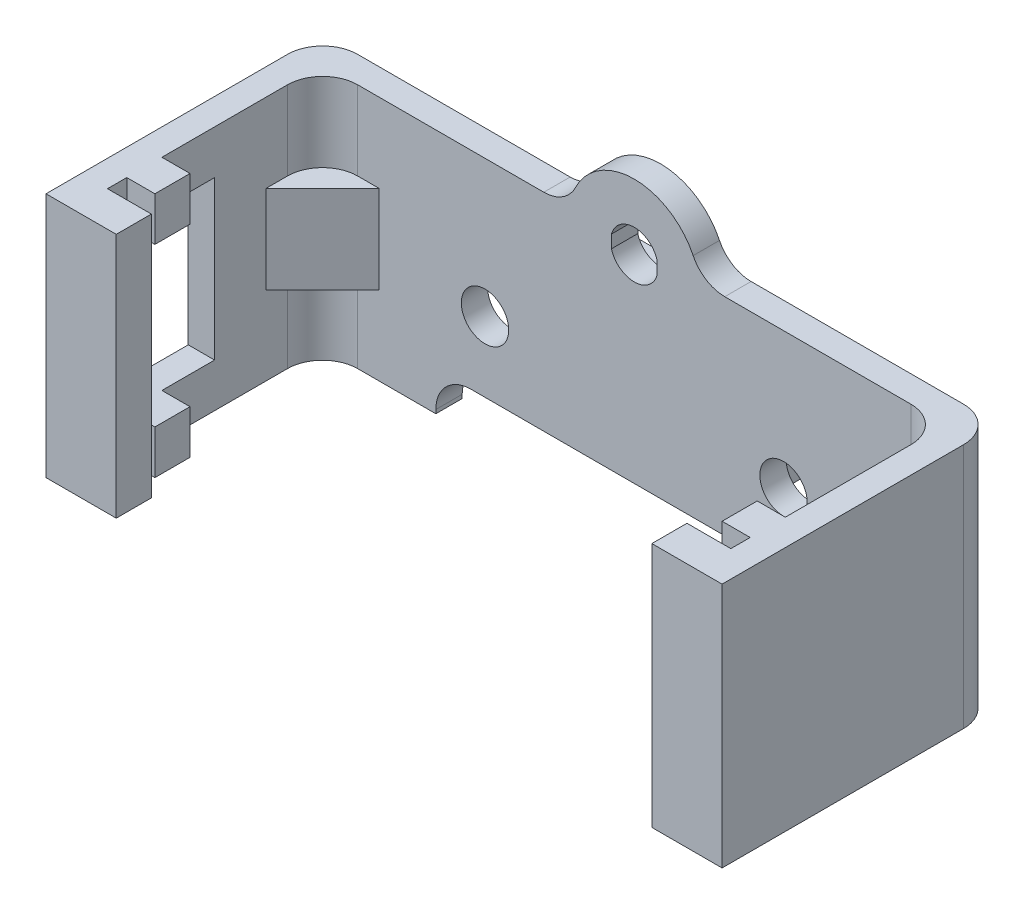
from build123d import *

# Parameters (mm, degrees)
SKETCH_1_W               = 27
SKETCH_1_H               = 17
EXTRUDE_1_DEPTH          = 1
SKETCH_2_R               = 2.55
CUT_EXTRUDE_1_DEPTH      = 16.984367363
EXTRUDE_2_DEPTH          = 17
SKETCH_6_W               = 1.5
SKETCH_6_H               = 2
EXTRUDE_3_DEPTH          = 2
CHAMFER_1_SIZE           = 1
CUT_EXTRUDE_4_REACH      = 39.316
SKETCH_8_R               = 2
FILLET_1_R               = 3
SKETCH_9_W               = 7
SKETCH_9_H               = 13
EXTRUDE_4_DEPTH          = 1.5
SKETCH_7_R               = 1.35
CUT_EXTRUDE_5_DEPTH      = 10
CUT_EXTRUDE_6_REACH      = 41.373
FILLET_2_R               = 2.2
SKETCH_13_W              = 11.6
SKETCH_13_H              = 5.4
EXTRUDE_6_DEPTH          = 4
CUT_EXTRUDE_7_DEPTH      = 44.188540186
CUT_EXTRUDE_7_DEPTH_BACK = 44.188540186
SKETCH_14_OUTSIDE_W      = 46.664
SKETCH_14_OUTSIDE_H      = 47.664
SKETCH_14_OUTSIDE_W_2    = 27
SKETCH_14_OUTSIDE_H_2    = 5.5
EXTRUDE_7_DEPTH          = 3.5
EXTRUDE_7_DEPTH_BACK     = 10.5
SKETCH_16_W              = 5.6
SKETCH_16_H              = 1.5
SKETCH_16_W_2            = 4.4
SKETCH_16_W_3            = 12.2
EXTRUDE_8_DEPTH          = 2
EXTRUDE_9_DEPTH          = 2.5
CUT_EXTRUDE_8_REACH      = 54.983
SKETCH_18_W              = 5
SKETCH_18_H              = 9
EXTRUDE_START            = -1.5
SKETCH_19_R              = 3.726433752
SKETCH_19_R_2            = 1.35
SKETCH_19_W              = 24.8
SKETCH_19_H              = 1.288897449
EXTRUDE_10_DEPTH         = 1.5
FILLET_4_R               = 2


# Some blends are built 0.0001 mm under size
with BuildPart() as part:
    # 草图1 → 凸台-拉伸1 (new body)
    with BuildSketch(Plane.XY):
        Rectangle(SKETCH_1_W, SKETCH_1_H)
    extrude(amount=EXTRUDE_1_DEPTH)

    # 草图2 → 切除-拉伸1 (cut, through all)
    with BuildSketch(Plane.XY.offset(1)):
        with Locations((0, 4.125)):
            Circle(SKETCH_2_R)
        with Locations((0, -4.125)):
            Circle(SKETCH_2_R)
        with Locations((8.27, 4.125)):
            Circle(SKETCH_2_R)
        with Locations((8.27, -4.125)):
            Circle(SKETCH_2_R)
        with Locations((-8.27, 4.125)):
            Circle(SKETCH_2_R)
        with Locations((-8.27, -4.125)):
            Circle(SKETCH_2_R)
    extrude(amount=-CUT_EXTRUDE_1_DEPTH, mode=Mode.SUBTRACT)

    # 草图3 → 凸台-拉伸2 (add)
    with BuildSketch(Plane.XZ.offset(8.5)):
        Polygon((13.5, 0), (19, 0), (19, -28.5), (-13.5, -28.5), (-13.5, -30), (20.5, -30), (20.5, 1), (13.5, 1), align=None)
    extrude(amount=-EXTRUDE_2_DEPTH)

    # 草图6 → 凸台-拉伸3 (add, symmetric)
    with BuildSketch(Plane(origin=(0, 0, 0), x_dir=(1, 0, 0), z_dir=(0, 1, 0))):
        Polygon((19, 0), (19, 5), (14, 0), align=None)
        Polygon((19, 28.5), (14, 28.5), (19, 23.5), align=None)
        with Locations((18.25, 20)):
            Rectangle(SKETCH_6_W, SKETCH_6_H)
    extrude(amount=EXTRUDE_3_DEPTH, both=True)

    # 倒角1
    chamfer_1_edges = [part.edges().sort_by_distance(p)[0] for p in [
        (-13.5, 0, 0),
    ]]
    chamfer(chamfer_1_edges, length=CHAMFER_1_SIZE - 0.0001)  # a hair under: the kernel refuses the full size

    # 草图8 → 切除-拉伸4 (cut, up to next)
    with BuildSketch(Plane(origin=(0, 0, 0), x_dir=(-1, 0, 0), z_dir=(0, 0, -1)), mode=Mode.PRIVATE) as cut_extrude_4_sk1:
        Circle(SKETCH_8_R)
    cut_extrude_4_tool1 = extrude(cut_extrude_4_sk1.sketch, amount=-CUT_EXTRUDE_4_REACH, mode=Mode.PRIVATE) & part.part
    add(cut_extrude_4_tool1.solids().sort_by_distance((0, 0, 0))[0], mode=Mode.SUBTRACT)

    # 圆角1
    fillet_1_edges = [part.edges().sort_by_distance(p)[0] for p in [
        (20.5, 0, 1),
        (20.5, 0, -30),
        (19, 5.25, -28.5),
        (19, 5.25, 0),
        (19, -5.25, 0),
        (19, -5.25, -28.5),
    ]]
    fillet(fillet_1_edges, radius=FILLET_1_R)

    # 草图9 → 凸台-拉伸4 (add)
    with BuildSketch(Plane(origin=(0, 0, -30), x_dir=(-1, 0, 0), z_dir=(0, 0, -1))):
        with Locations((0, 6.5)):
            Rectangle(SKETCH_9_W, SKETCH_9_H)
    extrude(amount=-EXTRUDE_4_DEPTH)

    # 草图7 → 切除-拉伸5 (cut)
    with BuildSketch(Plane(origin=(0, 0, -30), x_dir=(-1, 0, 0), z_dir=(0, 0, -1))):
        with Locations((0, 10)):
            Circle(SKETCH_7_R)
        with Locations((-8.5, 2.7)):
            Circle(SKETCH_7_R)
        with Locations((8.5, 2.7)):
            Circle(SKETCH_7_R)
    extrude(amount=-CUT_EXTRUDE_5_DEPTH, mode=Mode.SUBTRACT)

    # 草图11 → 切除-拉伸6 (cut, up to next)
    with BuildSketch(Plane(origin=(0, 0, -30), x_dir=(-1, 0, 0), z_dir=(0, 0, -1)), mode=Mode.PRIVATE) as cut_extrude_6_sk1:
        with BuildLine():
            Line((13.5, -8.5), (13.5, 0))
            Line((13.5, 0), (-9, 0))
            ThreePointArc((-9, 0), (-15.01040764, -2.48959236), (-17.5, -8.5))
            Line((-17.5, -8.5), (13.5, -8.5))
        make_face()
    cut_extrude_6_tool1 = extrude(cut_extrude_6_sk1.sketch, amount=-CUT_EXTRUDE_6_REACH, mode=Mode.PRIVATE) & part.part
    add(cut_extrude_6_tool1.solids().sort_by_distance((1.149624, -4.397011, -30))[0], mode=Mode.SUBTRACT)

    # 圆角2
    fillet_2_edges = [part.edges().sort_by_distance(p)[0] for p in [
        (-3.5, 13, -29.25),
        (-3.5, 8.5, -29.25),
        (3.5, 13, -29.25),
        (3.5, 8.5, -29.25),
        (-13.5, 0, -29.25),
        (-13.5, 8.5, -29.25),
    ]]
    fillet(fillet_2_edges, radius=FILLET_2_R)

    # 草图13 → 凸台-拉伸6 (add)
    with BuildSketch(Plane(origin=(0, 0, -30), x_dir=(-1, 0, 0), z_dir=(0, 0, -1))):
        with Locations((0, 2.7)):
            Rectangle(SKETCH_13_W, SKETCH_13_H)
    extrude(amount=EXTRUDE_6_DEPTH)

    # 草图14 outside → 切除-拉伸7 (cut, two sides: drawn at the far end of the back side and taken through both)
    with BuildSketch(Plane(origin=(0, 8.5, 0), x_dir=(1, 0, 0), z_dir=(0, 1, 0)).offset(-CUT_EXTRUDE_7_DEPTH_BACK)):
        with Locations((3.5, 16.5)):
            Rectangle(SKETCH_14_OUTSIDE_W, SKETCH_14_OUTSIDE_H)
        with Locations((0, 31.25)):
            Rectangle(SKETCH_14_OUTSIDE_W_2, SKETCH_14_OUTSIDE_H_2, mode=Mode.SUBTRACT)
    extrude(amount=CUT_EXTRUDE_7_DEPTH + CUT_EXTRUDE_7_DEPTH_BACK, mode=Mode.SUBTRACT)

    # 草图15 → 凸台-拉伸7 (add, two sides: drawn at the far end of the back side and taken through both)
    with BuildSketch(Plane.XZ.offset(-EXTRUDE_7_DEPTH_BACK)):
        Polygon((-19.25, -14.25), (-19.25, -30), (-11.3, -30), (-11.3, -28.5), (-17.75, -28.5), (-17.75, -19.35), (-16.15, -19.35), (-16.15, -17.35), (-17.75, -17.35), (-17.75, -16.25), (-15.25, -16.25), (-15.25, -14.25), align=None)
        Polygon((17.75, -28.5), (13.5, -28.5), (13.5, -30), (19.25, -30), (19.25, -14.25), (15.25, -14.25), (15.25, -16.25), (17.75, -16.25), (17.75, -17.35), (16.15, -17.35), (16.15, -19.35), (17.75, -19.35), align=None)
    extrude(amount=EXTRUDE_7_DEPTH + EXTRUDE_7_DEPTH_BACK)

    # 草图16 → 凸台-拉伸8 (add)
    with BuildSketch(Plane(origin=(0, 8.5, 0), x_dir=(1, 0, 0), z_dir=(0, 1, 0))):
        with Locations((-8.5, 29.25)):
            Rectangle(SKETCH_16_W, SKETCH_16_H)
        with Locations((-3.5, 29.25)):
            Rectangle(SKETCH_16_W_2, SKETCH_16_H)
        with Locations((7.4, 29.25)):
            Rectangle(SKETCH_16_W_3, SKETCH_16_H)
    extrude(amount=EXTRUDE_8_DEPTH)

    # 草图17 → 凸台-拉伸9 (add, symmetric)
    with BuildSketch(Plane(origin=(0, 3.5, 0), x_dir=(-1, 0, 0), z_dir=(0, -1, 0))):
        Polygon((17.75, 25.275), (14.525, 28.5), (17.75, 28.5), align=None)
        Polygon((-17.75, 25.275), (-17.75, 28.5), (-14.525, 28.5), align=None)
    extrude(amount=EXTRUDE_9_DEPTH, both=True)

    # 切除-拉伸8: up to this face of the body (flat: up to its plane)
    cut_extrude_8_end = Plane(part.part.faces().sort_by_distance((17.75, 3.5, -16.8))[0])
    # 草图18 → 切除-拉伸8 (cut, up to the picked face)
    with BuildSketch(Plane.ZY.offset(19.25), mode=Mode.PRIVATE) as cut_extrude_8_sk1:
        with Locations((-19.85, 3.5)):
            Rectangle(SKETCH_18_W, SKETCH_18_H)
    cut_extrude_8_tool1 = split(extrude(cut_extrude_8_sk1.sketch, amount=-CUT_EXTRUDE_8_REACH, mode=Mode.PRIVATE), bisect_by=cut_extrude_8_end, keep=Keep.BOTH, mode=Mode.PRIVATE)
    add(cut_extrude_8_tool1.solids().sort_by(Axis((-19.25, 3.5, -19.85), (1, 0, 0)))[0], mode=Mode.SUBTRACT)

    # 草图19 → 凸台-拉伸10 (add)
    # profile 1 of 2: a face of its own
    with BuildSketch(Plane.XY.offset(-28.5).offset(EXTRUDE_START)):
        with Locations((0, 10)):
            Circle(SKETCH_19_R)
        with Locations((0, 10)):
            Circle(SKETCH_19_R_2, mode=Mode.SUBTRACT)
    # profile 2 of 2: a face of its own
    with BuildSketch(Plane.XY.offset(-28.5).offset(EXTRUDE_START)):
        with Locations((1.1, -0.644448725)):
            Rectangle(SKETCH_19_W, SKETCH_19_H)
    extrude(amount=EXTRUDE_10_DEPTH)

    # 圆角4
    # the kernel refuses this fillet: 2 mm, written as the material it adds along each edge
    with BuildSketch(Plane(origin=(13.5, -1.288897449, -28.5), x_dir=(0, -1, 0), z_dir=(0, 0, -1))) as fillet_4_piece_1:
        with BuildLine():
            CenterArc((FILLET_4_R, FILLET_4_R), FILLET_4_R, 180, 90)
            Line((0, FILLET_4_R), (0, 0))
            Line((0, 0), (FILLET_4_R, 0))
        make_face()
    extrude(amount=1.5)
    with BuildSketch(Plane(origin=(17.75, 1, -28.5), x_dir=(-1, 0, 0), z_dir=(0, 1, 0)), Plane(origin=(-17.75, 6, -28.5), x_dir=(1, 0, 0), z_dir=(0, -1, 0)), Plane(origin=(-17.75, 10.5, -28.5), x_dir=(1, 0, 0), z_dir=(0, -1, 0)), Plane(origin=(17.75, -3.5, -28.5), x_dir=(-1, 0, 0), z_dir=(0, 1, 0))) as fillet_4_piece_2:
        with BuildLine():
            CenterArc((FILLET_4_R, FILLET_4_R), FILLET_4_R, 180, 90)
            Line((0, FILLET_4_R), (0, 0))
            Line((0, 0), (FILLET_4_R, 0))
        make_face()
    extrude(amount=9.5)
    with BuildSketch(Plane(origin=(-3.692737265, 10.5, -28.5), x_dir=(-1, 0, 0), z_dir=(0, 0, -1))) as fillet_4_piece_3:
        with BuildLine():
            CenterArc((1.459159814, 2), FILLET_4_R, 205.88535786, 64.11464214)
            ThreePointArc((-0.340178937, 1.126856222), (-0.125315404, 0.576944648), (0, 0))
            Line((0, 0), (1.459159814, 0))
        make_face()
    extrude(amount=1.5)
    with BuildSketch(Plane(origin=(3.692737265, 10.5, -28.5), x_dir=(-0.28900142054358374, 0.9573286681823493, 0), z_dir=(0, 0, -1))) as fillet_4_piece_4:
        with BuildLine():
            CenterArc((1.492958077, 1.974898363), FILLET_4_R, 196.798181975, 64.11464214)
            Line((-0.421699259, 1.396895522), (0, 0))
            ThreePointArc((0, 0), (0.588541981, 0.046769794), (1.177083962, 0))
        make_face()
    extrude(amount=1.5)
    with BuildSketch(Plane(origin=(-5.8, 0, -30), x_dir=(0, -1, 0), z_dir=(1, 0, 0))) as fillet_4_piece_5:
        with BuildLine():
            CenterArc((2, 1.869313554), FILLET_4_R, 180, 69.172765444)
            Line((0, 1.869313554), (0, 0))
            Line((0, 0), (1.288897449, 0))
        make_face()
    extrude(amount=11.6)
    with BuildSketch(Plane(origin=(-11.3, -1.288897449, -30), x_dir=(1, 0, 0), z_dir=(0, 0, 1))) as fillet_4_piece_6:
        with BuildLine():
            CenterArc((FILLET_4_R, -FILLET_4_R), FILLET_4_R, 90, 90)
            Line((0, -FILLET_4_R), (0, 0))
            Line((0, 0), (FILLET_4_R, 0))
        make_face()
    extrude(amount=1.5)
    # the kernel refuses this fillet: 2 mm, written as the material it takes off along each edge
    with BuildSketch(Plane(origin=(19.25, 15.5, -30), x_dir=(-1, 0, 0), z_dir=(0, -1, 0))) as fillet_4_2_piece_1:
        with BuildLine():
            CenterArc((FILLET_4_R, -FILLET_4_R), FILLET_4_R, 90, 90)
            Line((0, -FILLET_4_R), (0, 0))
            Line((0, 0), (FILLET_4_R, 0))
        make_face()
    extrude(amount=24, mode=Mode.SUBTRACT)
    with BuildSketch(Plane(origin=(-19.25, 15.5, -30), x_dir=(1, 0, 0), z_dir=(0, -1, 0))) as fillet_4_2_piece_2:
        with BuildLine():
            CenterArc((FILLET_4_R, FILLET_4_R), FILLET_4_R, 180, 90)
            Line((0, FILLET_4_R), (0, 0))
            Line((0, 0), (FILLET_4_R, 0))
        make_face()
    extrude(amount=24, mode=Mode.SUBTRACT)


solid = part.part
